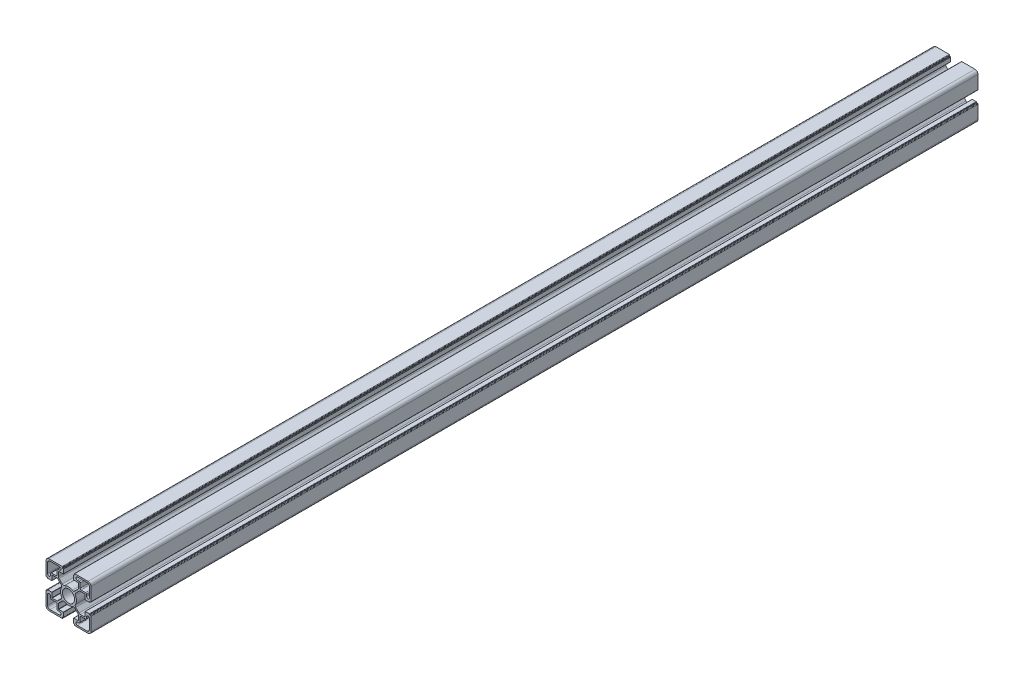
from build123d import *

# Parameters (mm, degrees)
BOSS_EXTRUDE1_DEPTH = 500.8
SCALE2_SCALE_X      = 0.564444
SCALE2_SCALE_Y      = 0.564444
SCALE2_SCALE_Z      = 1


with BuildPart() as part:
    # Sketch1 → Boss-Extrude1 (new body)
    with BuildSketch(Plane.XY):
        with BuildLine():
            Line((-22.5, 19.5), (-22.5, 6.3))
            ThreePointArc((-22.5, 6.3), (-22.353553391, 5.946446609), (-22, 5.8))
            Line((-22, 5.8), (-21.3, 5.8))
            ThreePointArc((-21.3, 5.8), (-21.087867966, 5.712132034), (-21, 5.5))
            Line((-21, 5.5), (-21, 5.3))
            ThreePointArc((-21, 5.3), (-20.912132034, 5.087867966), (-20.7, 5))
            Line((-20.7, 5), (-16.7, 5))
            ThreePointArc((-16.7, 5), (-16.558578644, 5.058578644), (-16.5, 5.2))
            Line((-16.5, 5.2), (-16.5, 9.8))
            ThreePointArc((-16.5, 9.8), (-16.441421356, 9.941421356), (-16.3, 10))
            Line((-16.3, 10), (-11.864234483, 10))
            ThreePointArc((-11.864234483, 10), (-11.121828624, 9.852326293), (-10.492447327, 9.431787156))
            Line((-10.492447327, 9.431787156), (-7.296699127, 6.236038955))
            ThreePointArc((-7.296699127, 6.236038955), (-6.746669172, 5.129240469), (-6.976648919, 3.914890784))
            ThreePointArc((-6.976648919, 3.914890784), (-7.739935121, 2.023216331), (-8, 0))
            ThreePointArc((-8, 0), (-7.739935121, -2.023216331), (-6.976648919, -3.914890784))
            ThreePointArc((-6.976648919, -3.914890784), (-6.746669172, -5.129240469), (-7.296699127, -6.236038955))
            Line((-7.296699127, -6.236038955), (-10.492447327, -9.431787156))
            ThreePointArc((-10.492447327, -9.431787156), (-11.121828624, -9.852326293), (-11.864234483, -10))
            Line((-11.864234483, -10), (-16.3, -10))
            ThreePointArc((-16.3, -10), (-16.441421356, -9.941421356), (-16.5, -9.8))
            Line((-16.5, -9.8), (-16.5, -5.2))
            ThreePointArc((-16.5, -5.2), (-16.558578644, -5.058578644), (-16.7, -5))
            Line((-16.7, -5), (-20.7, -5))
            ThreePointArc((-20.7, -5), (-20.912132034, -5.087867966), (-21, -5.3))
            Line((-21, -5.3), (-21, -5.5))
            ThreePointArc((-21, -5.5), (-21.087867966, -5.712132034), (-21.3, -5.8))
            Line((-21.3, -5.8), (-22, -5.8))
            ThreePointArc((-22, -5.8), (-22.353553391, -5.946446609), (-22.5, -6.3))
            Line((-22.5, -6.3), (-22.5, -19.5))
            ThreePointArc((-22.5, -19.5), (-21.621320344, -21.621320344), (-19.5, -22.5))
            Line((-19.5, -22.5), (-6.3, -22.5))
            ThreePointArc((-6.3, -22.5), (-5.946446609, -22.353553391), (-5.8, -22))
            Line((-5.8, -22), (-5.8, -21.3))
            ThreePointArc((-5.8, -21.3), (-5.712132034, -21.087867966), (-5.5, -21))
            Line((-5.5, -21), (-5.3, -21))
            ThreePointArc((-5.3, -21), (-5.087867966, -20.912132034), (-5, -20.7))
            Line((-5, -20.7), (-5, -16.7))
            ThreePointArc((-5, -16.7), (-5.058578644, -16.558578644), (-5.2, -16.5))
            Line((-5.2, -16.5), (-9.8, -16.5))
            ThreePointArc((-9.8, -16.5), (-9.941421356, -16.441421356), (-10, -16.3))
            Line((-10, -16.3), (-10, -11.864234483))
            ThreePointArc((-10, -11.864234483), (-9.852326293, -11.121828624), (-9.431787156, -10.492447327))
            Line((-9.431787156, -10.492447327), (-6.236038955, -7.296699127))
            ThreePointArc((-6.236038955, -7.296699127), (-5.129240469, -6.746669172), (-3.914890784, -6.976648919))
            ThreePointArc((-3.914890784, -6.976648919), (-2.023216331, -7.739935121), (0, -8))
            ThreePointArc((0, -8), (2.023216331, -7.739935121), (3.914890784, -6.976648919))
            ThreePointArc((3.914890784, -6.976648919), (5.129240469, -6.746669172), (6.236038955, -7.296699127))
            Line((6.236038955, -7.296699127), (9.431787156, -10.492447327))
            ThreePointArc((9.431787156, -10.492447327), (9.852326293, -11.121828624), (10, -11.864234483))
            Line((10, -11.864234483), (10, -16.3))
            ThreePointArc((10, -16.3), (9.941421356, -16.441421356), (9.8, -16.5))
            Line((9.8, -16.5), (5.2, -16.5))
            ThreePointArc((5.2, -16.5), (5.058578644, -16.558578644), (5, -16.7))
            Line((5, -16.7), (5, -20.7))
            ThreePointArc((5, -20.7), (5.087867966, -20.912132034), (5.3, -21))
            Line((5.3, -21), (5.5, -21))
            ThreePointArc((5.5, -21), (5.712132034, -21.087867966), (5.8, -21.3))
            Line((5.8, -21.3), (5.8, -22))
            ThreePointArc((5.8, -22), (5.946446609, -22.353553391), (6.3, -22.5))
            Line((6.3, -22.5), (19.5, -22.5))
            ThreePointArc((19.5, -22.5), (21.621320344, -21.621320344), (22.5, -19.5))
            Line((22.5, -19.5), (22.5, -6.3))
            ThreePointArc((22.5, -6.3), (22.353553391, -5.946446609), (22, -5.8))
            Line((22, -5.8), (21.3, -5.8))
            ThreePointArc((21.3, -5.8), (21.087867966, -5.712132034), (21, -5.5))
            Line((21, -5.5), (21, -5.3))
            ThreePointArc((21, -5.3), (20.912132034, -5.087867966), (20.7, -5))
            Line((20.7, -5), (16.7, -5))
            ThreePointArc((16.7, -5), (16.558578644, -5.058578644), (16.5, -5.2))
            Line((16.5, -5.2), (16.5, -9.8))
            ThreePointArc((16.5, -9.8), (16.441421356, -9.941421356), (16.3, -10))
            Line((16.3, -10), (11.864234483, -10))
            ThreePointArc((11.864234483, -10), (11.121828624, -9.852326293), (10.492447327, -9.431787156))
            Line((10.492447327, -9.431787156), (7.296699127, -6.236038955))
            ThreePointArc((7.296699127, -6.236038955), (6.746669172, -5.129240469), (6.976648919, -3.914890784))
            ThreePointArc((6.976648919, -3.914890784), (7.739935121, -2.023216331), (8, 0))
            ThreePointArc((8, 0), (7.739935121, 2.023216331), (6.976648919, 3.914890784))
            ThreePointArc((6.976648919, 3.914890784), (6.746669172, 5.129240469), (7.296699127, 6.236038955))
            Line((7.296699127, 6.236038955), (10.492447327, 9.431787156))
            ThreePointArc((10.492447327, 9.431787156), (11.121828624, 9.852326293), (11.864234483, 10))
            Line((11.864234483, 10), (16.3, 10))
            ThreePointArc((16.3, 10), (16.441421356, 9.941421356), (16.5, 9.8))
            Line((16.5, 9.8), (16.5, 5.2))
            ThreePointArc((16.5, 5.2), (16.558578644, 5.058578644), (16.7, 5))
            Line((16.7, 5), (20.7, 5))
            ThreePointArc((20.7, 5), (20.912132034, 5.087867966), (21, 5.3))
            Line((21, 5.3), (21, 5.5))
            ThreePointArc((21, 5.5), (21.087867966, 5.712132034), (21.3, 5.8))
            Line((21.3, 5.8), (22, 5.8))
            ThreePointArc((22, 5.8), (22.353553391, 5.946446609), (22.5, 6.3))
            Line((22.5, 6.3), (22.5, 19.5))
            ThreePointArc((22.5, 19.5), (21.621320344, 21.621320344), (19.5, 22.5))
            Line((19.5, 22.5), (6.3, 22.5))
            ThreePointArc((6.3, 22.5), (5.946446609, 22.353553391), (5.8, 22))
            Line((5.8, 22), (5.8, 21.3))
            ThreePointArc((5.8, 21.3), (5.712132034, 21.087867966), (5.5, 21))
            Line((5.5, 21), (5.3, 21))
            ThreePointArc((5.3, 21), (5.087867966, 20.912132034), (5, 20.7))
            Line((5, 20.7), (5, 16.7))
            ThreePointArc((5, 16.7), (5.058578644, 16.558578644), (5.2, 16.5))
            Line((5.2, 16.5), (9.8, 16.5))
            ThreePointArc((9.8, 16.5), (9.941421356, 16.441421356), (10, 16.3))
            Line((10, 16.3), (10, 11.864234483))
            ThreePointArc((10, 11.864234483), (9.852326293, 11.121828624), (9.431787156, 10.492447327))
            Line((9.431787156, 10.492447327), (6.236038955, 7.296699127))
            ThreePointArc((6.236038955, 7.296699127), (5.129240469, 6.746669172), (3.914890784, 6.976648919))
            ThreePointArc((3.914890784, 6.976648919), (2.023216331, 7.739935121), (0, 8))
            ThreePointArc((0, 8), (-2.023216331, 7.739935121), (-3.914890784, 6.976648919))
            ThreePointArc((-3.914890784, 6.976648919), (-5.129240469, 6.746669172), (-6.236038955, 7.296699127))
            Line((-6.236038955, 7.296699127), (-9.431787156, 10.492447327))
            ThreePointArc((-9.431787156, 10.492447327), (-9.852326293, 11.121828624), (-10, 11.864234483))
            Line((-10, 11.864234483), (-10, 16.3))
            ThreePointArc((-10, 16.3), (-9.941421356, 16.441421356), (-9.8, 16.5))
            Line((-9.8, 16.5), (-5.2, 16.5))
            ThreePointArc((-5.2, 16.5), (-5.058578644, 16.558578644), (-5, 16.7))
            Line((-5, 16.7), (-5, 20.7))
            ThreePointArc((-5, 20.7), (-5.087867966, 20.912132034), (-5.3, 21))
            Line((-5.3, 21), (-5.5, 21))
            ThreePointArc((-5.5, 21), (-5.712132034, 21.087867966), (-5.8, 21.3))
            Line((-5.8, 21.3), (-5.8, 22))
            ThreePointArc((-5.8, 22), (-5.946446609, 22.353553391), (-6.3, 22.5))
            Line((-6.3, 22.5), (-19.5, 22.5))
            ThreePointArc((-19.5, 22.5), (-21.621320344, 21.621320344), (-22.5, 19.5))
        make_face()
        with BuildLine():
            Line((-21, 18.5), (-21, 9))
            ThreePointArc((-21, 9), (-19.5, 7.5), (-18, 9))
            Line((-18, 9), (-18, 10.5))
            ThreePointArc((-18, 10.5), (-17.707106781, 11.207106781), (-17, 11.5))
            Line((-17, 11.5), (-12.5, 11.5))
            ThreePointArc((-12.5, 11.5), (-11.792893219, 11.792893219), (-11.5, 12.5))
            Line((-11.5, 12.5), (-11.5, 17))
            ThreePointArc((-11.5, 17), (-11.207106781, 17.707106781), (-10.5, 18))
            Line((-10.5, 18), (-9, 18))
            ThreePointArc((-9, 18), (-7.5, 19.5), (-9, 21))
            Line((-9, 21), (-18.5, 21))
            ThreePointArc((-18.5, 21), (-20.267766953, 20.267766953), (-21, 18.5))
        make_face(mode=Mode.SUBTRACT)
        with BuildLine():
            Line((18.5, 21), (9, 21))
            ThreePointArc((9, 21), (7.5, 19.5), (9, 18))
            Line((9, 18), (10.5, 18))
            ThreePointArc((10.5, 18), (11.207106781, 17.707106781), (11.5, 17))
            Line((11.5, 17), (11.5, 12.5))
            ThreePointArc((11.5, 12.5), (11.792893219, 11.792893219), (12.5, 11.5))
            Line((12.5, 11.5), (17, 11.5))
            ThreePointArc((17, 11.5), (17.707106781, 11.207106781), (18, 10.5))
            Line((18, 10.5), (18, 9))
            ThreePointArc((18, 9), (19.5, 7.5), (21, 9))
            Line((21, 9), (21, 18.5))
            ThreePointArc((21, 18.5), (20.267766953, 20.267766953), (18.5, 21))
        make_face(mode=Mode.SUBTRACT)
        with BuildLine():
            Line((21, -18.5), (21, -9))
            ThreePointArc((21, -9), (19.5, -7.5), (18, -9))
            Line((18, -9), (18, -10.5))
            ThreePointArc((18, -10.5), (17.707106781, -11.207106781), (17, -11.5))
            Line((17, -11.5), (12.5, -11.5))
            ThreePointArc((12.5, -11.5), (11.792893219, -11.792893219), (11.5, -12.5))
            Line((11.5, -12.5), (11.5, -17))
            ThreePointArc((11.5, -17), (11.207106781, -17.707106781), (10.5, -18))
            Line((10.5, -18), (9, -18))
            ThreePointArc((9, -18), (7.5, -19.5), (9, -21))
            Line((9, -21), (18.5, -21))
            ThreePointArc((18.5, -21), (20.267766953, -20.267766953), (21, -18.5))
        make_face(mode=Mode.SUBTRACT)
        with BuildLine():
            Line((-18.5, -21), (-9, -21))
            ThreePointArc((-9, -21), (-7.5, -19.5), (-9, -18))
            Line((-9, -18), (-10.5, -18))
            ThreePointArc((-10.5, -18), (-11.207106781, -17.707106781), (-11.5, -17))
            Line((-11.5, -17), (-11.5, -12.5))
            ThreePointArc((-11.5, -12.5), (-11.792893219, -11.792893219), (-12.5, -11.5))
            Line((-12.5, -11.5), (-17, -11.5))
            ThreePointArc((-17, -11.5), (-17.707106781, -11.207106781), (-18, -10.5))
            Line((-18, -10.5), (-18, -9))
            ThreePointArc((-18, -9), (-19.5, -7.5), (-21, -9))
            Line((-21, -9), (-21, -18.5))
            ThreePointArc((-21, -18.5), (-20.267766953, -20.267766953), (-18.5, -21))
        make_face(mode=Mode.SUBTRACT)
        with BuildLine():
            ThreePointArc((0, 6.1), (-4.313351365, 4.313351365), (-6.1, 0))
            ThreePointArc((-6.1, 0), (-4.313351365, -4.313351365), (0, -6.1))
            ThreePointArc((0, -6.1), (4.313351365, -4.313351365), (6.1, 0))
            ThreePointArc((6.1, 0), (4.313351365, 4.313351365), (0, 6.1))
        make_face(mode=Mode.SUBTRACT)
    extrude(amount=BOSS_EXTRUDE1_DEPTH)


with BuildPart() as part_1:
    # Scale2: scaled about (0, 0, 250.4)
    add(part.part.scale((SCALE2_SCALE_X, SCALE2_SCALE_Y, SCALE2_SCALE_Z), about=(0, 0, 250.4)))


solid = part_1.part
